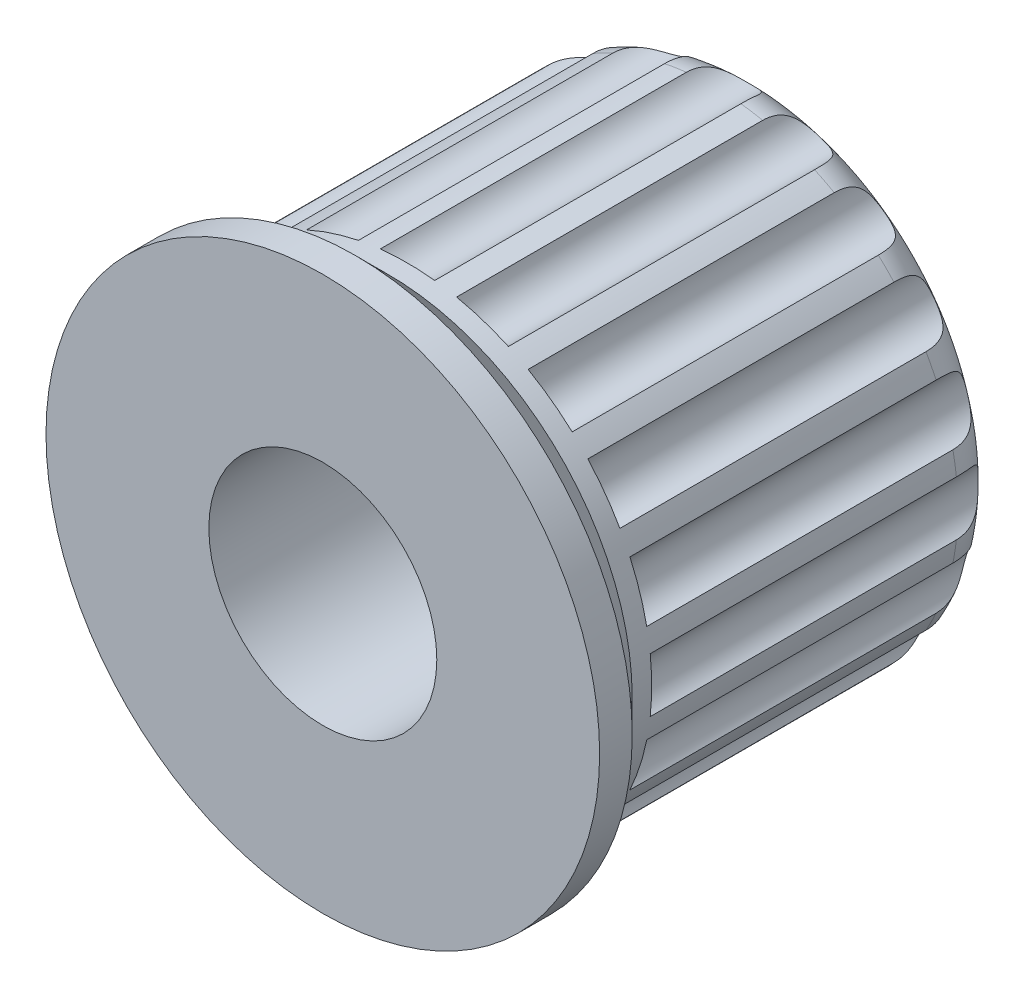
from build123d import *

# Parameters (mm, degrees)
SKETCH1_R           = 2.975
BOSS_EXTRUDE1_DEPTH = 2
SKETCH1_3_R         = 7.5
SKETCH1_3_R_2       = 2.975
BOSS_EXTRUDE3_DEPTH = 13.5
CUT_EXTRUDE1_START  = -5.5
SKETCH2_R           = 3.5
SKETCH2_R_2         = 2.975
CUT_EXTRUDE1_DEPTH  = 5.5
BOSS_EXTRUDE4_START = -2
SKETCH3_R           = 8.5
SKETCH3_R_2         = 7.5
BOSS_EXTRUDE4_DEPTH = 2
FILLET2_R           = 1.5
SKETCH5_R           = 1
CUT_EXTRUDE2_DEPTH  = 10.9
CIRPATTERN1_COUNT   = 20
CHAMFER1_SIZE       = 1


with BuildPart() as part:
    # Sketch1 → Boss-Extrude1 (new body)
    with BuildSketch(Plane.XY):
        Circle(SKETCH1_R)
    extrude(amount=BOSS_EXTRUDE1_DEPTH)

    # Sketch1<3> → Boss-Extrude3 (add)
    with BuildSketch(Plane.XY):
        with Locations(Location((0, 0, 0), (0, 0, 180))):
            Circle(SKETCH1_3_R)
        with Locations(Location((0, 0, 0), (0, 0, 180))):
            Circle(SKETCH1_3_R_2, mode=Mode.SUBTRACT)
    extrude(amount=BOSS_EXTRUDE3_DEPTH)

    # Sketch2 → Cut-Extrude1 (cut)
    with BuildSketch(Plane.XY.offset(13.5).offset(CUT_EXTRUDE1_START)):
        Circle(SKETCH2_R)
        with Locations(Location((0, 0, 0), (0, 0, 180))):
            Circle(SKETCH2_R_2, mode=Mode.SUBTRACT)
    extrude(amount=CUT_EXTRUDE1_DEPTH, mode=Mode.SUBTRACT)

    # Sketch3 → Boss-Extrude4 (add)
    with BuildSketch(Plane.XY.offset(13.5).offset(BOSS_EXTRUDE4_START)):
        Circle(SKETCH3_R)
        with Locations(Location((0, 0, 0), (0, 0, 180))):
            Circle(SKETCH3_R_2, mode=Mode.SUBTRACT)
    extrude(amount=BOSS_EXTRUDE4_DEPTH)

    # Fillet2
    fillet2_edges = [part.edges().sort_by_distance(p)[0] for p in [
        (7.5, 0, 0),
    ]]
    fillet(fillet2_edges, radius=FILLET2_R)

    # Sketch5 → Cut-Extrude2 (cut)
    with BuildSketch(Plane(origin=(0, 0, 0), x_dir=(-1, 0, 0), z_dir=(0, 0, -1))):
        with Locations((0, 8)):
            Circle(SKETCH5_R)
    cut_extrude2 = extrude(amount=-CUT_EXTRUDE2_DEPTH, mode=Mode.SUBTRACT)

    # CirPattern1: Cut-Extrude2 ×20 about axis
    cirpattern1_axis = Axis((0, 0, 0), (0, 0, 1))
    for i in range(1, CIRPATTERN1_COUNT):
        add(cut_extrude2.rotate(cirpattern1_axis, i * 360 / CIRPATTERN1_COUNT), mode=Mode.SUBTRACT)

    # Chamfer1
    chamfer1_edges = [part.edges().sort_by_distance(p)[0] for p in [
        (-8.5, 0, 11.5),
    ]]
    chamfer(chamfer1_edges, length=CHAMFER1_SIZE - 0.0001)  # a hair under: the kernel refuses the full size


solid = part.part
